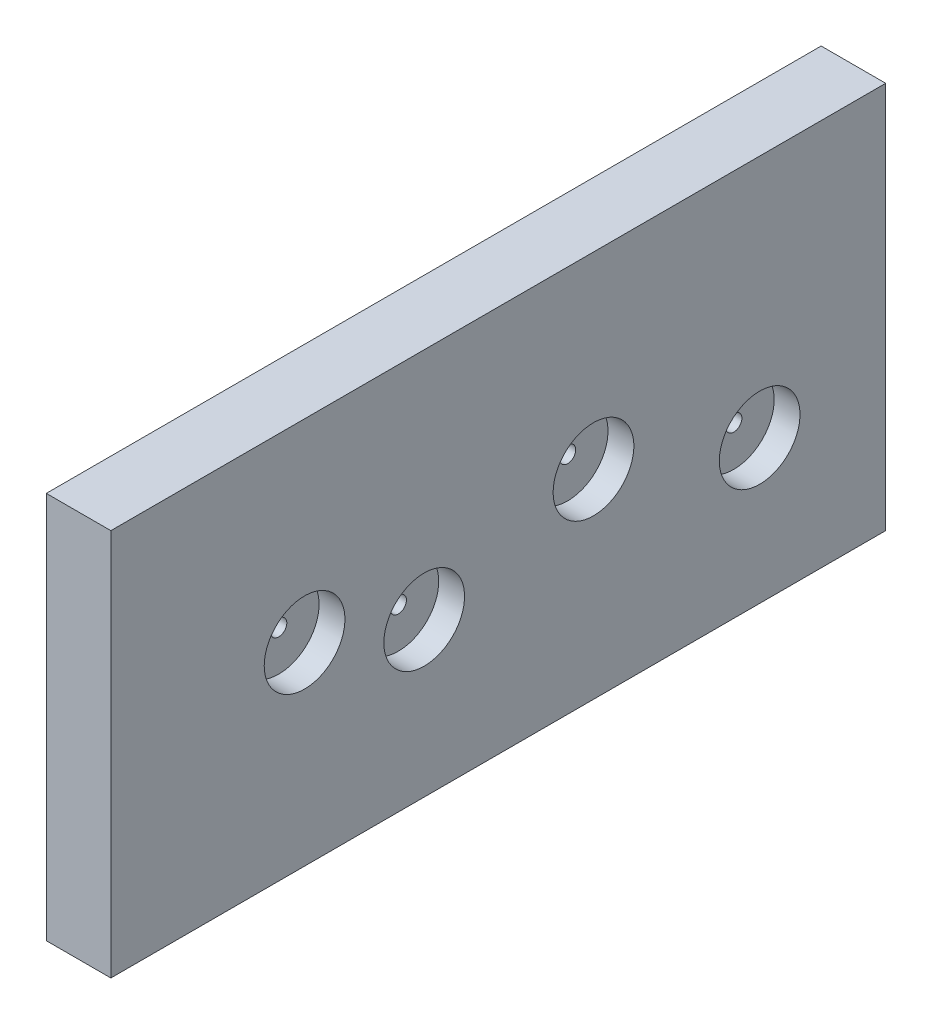
from build123d import *

# Parameters (mm, degrees)
SKETCH1_W                       = 152.4
SKETCH1_H                       = 76.2
SKETCH1_R                       = 1.5875
BOSS_EXTRUDE1_DEPTH             = 12.7
SKETCH2_R                       = 7.9375
CUT_EXTRUDE1_DEPTH              = 5.08
F_1_4_0_25_DIAMETER_HOLE1_D     = 6.35
F_1_4_0_25_DIAMETER_HOLE1_DEPTH = 38.1
F_1_4_0_25_DIAMETER_HOLE1_TIP   = 1.907732465


with BuildPart() as part:
    # Sketch1 → Boss-Extrude1 (new body)
    with BuildSketch(Plane(origin=(0, 0, 0), x_dir=(0, 0, -1), z_dir=(1, 0, 0))):
        Rectangle(SKETCH1_W, SKETCH1_H)
        with Locations((18.72253158, 1.096077429)):
            Circle(SKETCH1_R, mode=Mode.SUBTRACT)
        with Locations((-38.1, 0)):
            Circle(SKETCH1_R, mode=Mode.SUBTRACT)
        with Locations((-14.571224015, -7.860160654)):
            Circle(SKETCH1_R, mode=Mode.SUBTRACT)
        with Locations((51.408255992, -9.873506971)):
            Circle(SKETCH1_R, mode=Mode.SUBTRACT)
    extrude(amount=BOSS_EXTRUDE1_DEPTH)

    # Sketch2 → Cut-Extrude1 (cut)
    with BuildSketch(Plane.ZY.offset(-12.7)):
        with Locations((38.1, 0)):
            Circle(SKETCH2_R)
        with Locations((14.571224015, -7.860160654)):
            Circle(SKETCH2_R)
        with Locations((-18.72253158, 1.096077429)):
            Circle(SKETCH2_R)
        with Locations((-51.408255992, -9.873506971)):
            Circle(SKETCH2_R)
    extrude(amount=CUT_EXTRUDE1_DEPTH, mode=Mode.SUBTRACT)

    # 1/4 (0.25) Diameter Hole1
    with Locations(Plane.XZ.offset(38.1)):
        with Locations((6.35, -63.5), (6.35, 0), (6.35, 57.15)):
            Hole(F_1_4_0_25_DIAMETER_HOLE1_D / 2, depth=F_1_4_0_25_DIAMETER_HOLE1_DEPTH)
            with Locations((0, 0, -(F_1_4_0_25_DIAMETER_HOLE1_DEPTH + F_1_4_0_25_DIAMETER_HOLE1_TIP / 2))):  # 118° drill point
                Cone(0, F_1_4_0_25_DIAMETER_HOLE1_D / 2, F_1_4_0_25_DIAMETER_HOLE1_TIP, mode=Mode.SUBTRACT)


solid = part.part
